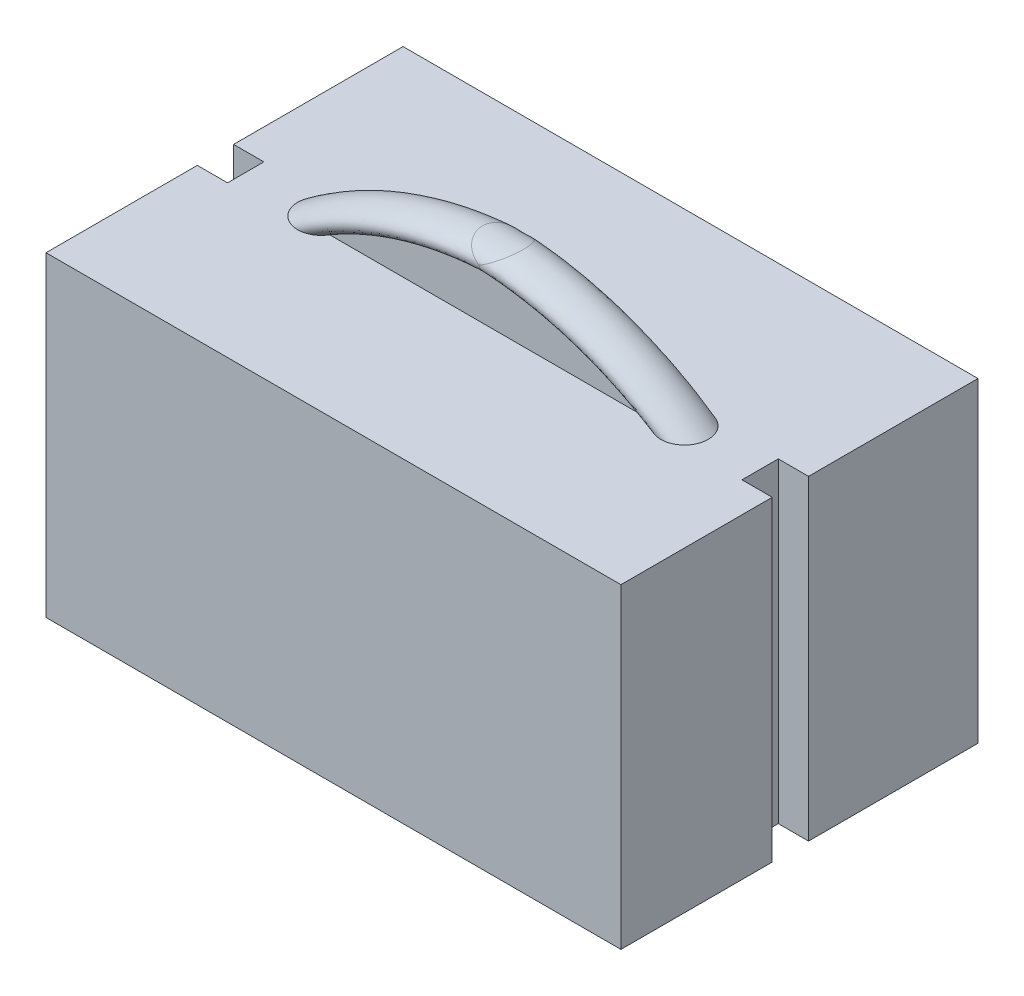
from build123d import *

# Parameters (mm, degrees)
BOSS_EXTRU_1_DEPTH = 0.8
BOSS_EXTRU_2_DEPTH = 24.5
BOSS_EXTRU_3_DEPTH = 0.8
ESQUISSE4_W        = 30
ESQUISSE4_H        = 2
BOSS_EXTRU_4_DEPTH = 5
CONG_1_R           = 30
ESQUISSE5_R        = 1.961993539
ESQUISSE6_R        = 1.961993539


with BuildPart() as part:
    # Esquisse1 → Boss.-Extru.1 (new body)
    with BuildSketch(Plane(origin=(0, 0, 0), x_dir=(1, 0, 0), z_dir=(0, 1, 0))):
        Polygon((-10.117450738, 16.869565217), (37.382549262, 16.869565217), (37.382549262, 2.869565217), (34.882549262, 2.869565217), (34.882549262, -0.130434783), (37.382549262, -0.130434783), (37.382549262, -12.630434783), (-10.117450738, -12.630434783), (-10.117450738, -0.130434783), (-7.617450738, -0.130434783), (-7.617450738, 2.869565217), (-10.117450738, 2.869565217), align=None)
    extrude(amount=BOSS_EXTRU_1_DEPTH)

    # Esquisse2 → Boss.-Extru.2 (add)
    with BuildSketch(Plane(origin=(0, 0.8, 0), x_dir=(1, 0, 0), z_dir=(0, 1, 0))):
        Polygon((-9.117450738, 16.869565217), (-9.117450738, 3.869565217), (-6.617450738, 3.869565217), (-6.617450738, -1.130434783), (-9.117450738, -1.130434783), (-9.117450738, -11.630434783), (36.382549262, -11.630434783), (36.382549262, -1.130434783), (33.882549262, -1.130434783), (33.882549262, 3.869565217), (36.382549262, 3.869565217), (36.382549262, 16.869565217), (37.382549262, 16.869565217), (37.382549262, 2.869565217), (34.882549262, 2.869565217), (34.882549262, -0.130434783), (37.382549262, -0.130434783), (37.382549262, -12.630434783), (-10.117450738, -12.630434783), (-10.117450738, -0.130434783), (-7.617450738, -0.130434783), (-7.617450738, 2.869565217), (-10.117450738, 2.869565217), (-10.117450738, 16.869565217), align=None)
    extrude(amount=BOSS_EXTRU_2_DEPTH)

    # Esquisse3 → Boss.-Extru.3 (add)
    with BuildSketch(Plane(origin=(0, 25.3, 0), x_dir=(1, 0, 0), z_dir=(0, 1, 0))):
        Polygon((-10.117450738, 16.869565217), (-10.117450738, 2.869565217), (-7.617450738, 2.869565217), (-7.617450738, -0.130434783), (-10.117450738, -0.130434783), (-10.117450738, -12.630434783), (37.382549262, -12.630434783), (37.382549262, -0.130434783), (34.882549262, -0.130434783), (34.882549262, 2.869565217), (37.382549262, 2.869565217), (37.382549262, 16.869565217), align=None)
    extrude(amount=BOSS_EXTRU_3_DEPTH)

    # Esquisse4 → Boss.-Extru.4 (add)
    with BuildSketch(Plane(origin=(0, 26.1, 0), x_dir=(1, 0, 0), z_dir=(0, 1, 0))):
        with Locations((13.632549262, 1.369565217)):
            Rectangle(ESQUISSE4_W, ESQUISSE4_H)
    extrude(amount=BOSS_EXTRU_4_DEPTH)

    # Congé1
    # the kernel refuses this fillet: 30 mm, written as the material it takes off along each edge
    with BuildSketch(Plane(origin=(28.632549262, 31.1, -43.827375097), x_dir=(0, -1, 0), z_dir=(0, 0, 1)), Plane(origin=(-1.367450738, 31.1, 41.088244662), x_dir=(0, -1, 0), z_dir=(0, 0, -1))) as cong_1_piece_1:
        with BuildLine():
            CenterArc((30, -16.583123952), CONG_1_R, 146.442690238, 33.557309762)
            Line((0, -16.583123952), (-0.6, -16.583123952))
            Line((-0.6, -16.583123952), (-0.6, 0))
            Line((-0.6, 0), (0, 0.6))
            ThreePointArc((0, 0.6), (2.5, 0.6), (4.5, 0.331662479))
            Line((4.5, 0.331662479), (5, 0))
        make_face()
    extrude(amount=84.915619759, mode=Mode.SUBTRACT)

    # Balayage1: sweep along a curve in space
    with BuildLine() as balayage1_path:
        ThreePointArc((13.632549262, 31.058199521, -0.369565217), (5.800309368, 29.584222364, -0.369565217), (-1.367450738, 26.1, -0.369565217))
    # Esquisse5 → Balayage1 (sweep)
    with BuildSketch(Plane(origin=(0, 26.1, 0), x_dir=(1, 0, 0), z_dir=(0, 1, 0))):
        with Locations((-1.367450738, 1.369565217)):
            Circle(ESQUISSE5_R)
    sweep(path=balayage1_path.line)

    # Balayage2: sweep along a curve in space
    with BuildLine() as balayage2_path:
        ThreePointArc((28.632549262, 26.1, -0.369565217), (21.464789156, 29.584222364, -0.369565217), (13.632549262, 31.058199521, -0.369565217))
    # Esquisse6 → Balayage2 (sweep)
    with BuildSketch(Plane(origin=(0, 26.1, 0), x_dir=(1, 0, 0), z_dir=(0, 1, 0))):
        with Locations((28.632549262, 1.369565217)):
            Circle(ESQUISSE6_R)
    sweep(path=balayage2_path.line)

    # Lissage1: read off the stored shape, not the designer's step
    # Lissage1: loft between two sections, ruled curve by curve
    lissage1_from = [
        Edge.make_bspline([(13.632549262, 31.058199521, -3.331558756), (13.491720249, 31.141261324, -3.331558756), (13.332414469, 31.235220835, -3.311677222), (12.986313087, 31.439353521, -3.194480808), (12.798841505, 31.549925392, -3.096119531), (12.438319232, 31.762563607, -2.782200565), (12.266166728, 31.864100194, -2.564412494), (12.016670345, 32.011254668, -2.021300095), (11.942601106, 32.054941152, -1.696564141), (11.942601106, 32.054941152, -1.042566294), (12.016670345, 32.011254668, -0.717830339), (12.266166728, 31.864100194, -0.174717941), (12.438319232, 31.762563607, 0.04307013), (12.798841505, 31.549925392, 0.356989097), (12.986313087, 31.439353521, 0.455350373), (13.332414469, 31.235220835, 0.572546787), (13.491720249, 31.141261324, 0.592428321), (13.632549262, 31.058199521, 0.592428321)], [0, 0, 0, 0, 0.125, 0.125, 0.25, 0.25, 0.375, 0.375, 0.5, 0.5, 0.625, 0.625, 0.75, 0.75, 0.875, 0.875, 1, 1, 1, 1], 3),
        Edge.make_line((13.632549262, 31.058199521, 0.592428321), (13.632549262, 31.058199521, -3.331558756)),
    ]
    lissage1_to = [
        Edge.make_bspline([(13.632549262, 31.058199521, -3.331558756), (13.773378275, 31.141261324, -3.331558756), (13.932684054, 31.235220835, -3.311677222), (14.278785436, 31.439353521, -3.194480808), (14.466257018, 31.549925392, -3.096119531), (14.826779291, 31.762563607, -2.782200565), (14.998931796, 31.864100194, -2.564412494), (15.248428178, 32.011254668, -2.021300095), (15.322497417, 32.054941152, -1.696564141), (15.322497417, 32.054941152, -1.042566294), (15.248428178, 32.011254668, -0.717830339), (14.998931796, 31.864100194, -0.174717941), (14.826779291, 31.762563607, 0.04307013), (14.466257018, 31.549925392, 0.356989097), (14.278785436, 31.439353521, 0.455350373), (13.932684054, 31.235220835, 0.572546787), (13.773378275, 31.141261324, 0.592428321), (13.632549262, 31.058199521, 0.592428321)], [0, 0, 0, 0, 0.125, 0.125, 0.25, 0.25, 0.375, 0.375, 0.5, 0.5, 0.625, 0.625, 0.75, 0.75, 0.875, 0.875, 1, 1, 1, 1], 3),
        Edge.make_line((13.632549262, 31.058199521, 0.592428321), (13.632549262, 31.058199521, -3.331558756)),
    ]
    lissage1 = Solid(Shell([*[Face.make_surface_from_curves(lissage1_from[k], lissage1_to[k]) for k in range(2)], Face(Wire(lissage1_from)), Face(Wire(lissage1_to))]))
    add(lissage1)


solid = part.part
